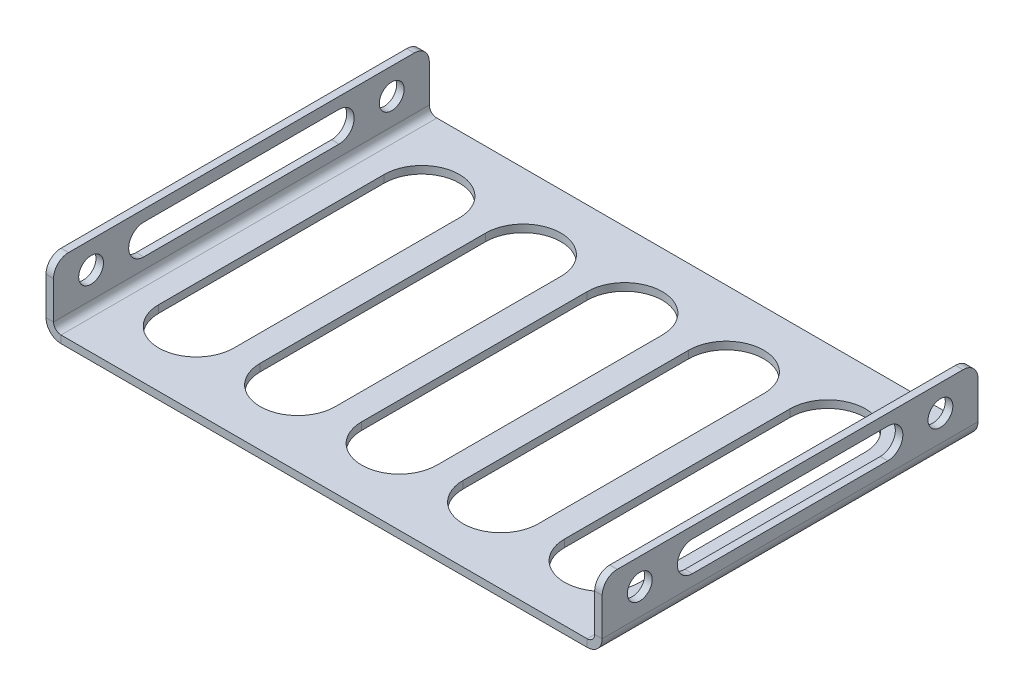
from build123d import *

# Parameters (mm, degrees)
SM_BASE_FLANGE_1_DEPTH   = 25
CUT_EXTRUDE_1_DEPTH      = 46.365184889
CUT_EXTRUDE_1_DEPTH_BACK = 46.365184889
SKETCH_6_R               = 1.65
CUT_EXTRUDE_2_DEPTH      = 10
FILLET_1_R               = 2


# Sheet-metal steps are written as plain solids
with BuildPart() as part:
    # Sketch 1 → 基体-法兰1 (new, symmetric)
    with BuildSketch(Plane.XY):
        with BuildLine():
            Line((-36, 8), (-36, 1))
            ThreePointArc((-36, 1), (-35.707106781, 0.292893219), (-35, 0))
            Line((-35, 0), (35, 0))
            ThreePointArc((35, 0), (35.707106781, 0.292893219), (36, 1))
            Line((36, 1), (36, 8))
            Line((36, 8), (37, 8))
            Line((37, 8), (37, 1))
            ThreePointArc((37, 1), (36.414213562, -0.414213562), (35, -1))
            Line((35, -1), (-35, -1))
            ThreePointArc((-35, -1), (-36.414213562, -0.414213562), (-37, 1))
            Line((-37, 1), (-37, 8))
            Line((-37, 8), (-36, 8))
        make_face()
    extrude(amount=SM_BASE_FLANGE_1_DEPTH, both=True)

    # 草图6 → 切除-拉伸1 (cut, two sides: drawn at the far end of the back side and taken through both)
    with BuildSketch(Plane(origin=(0, 0, 0), x_dir=(0, 0, -1), z_dir=(1, 0, 0)).offset(-CUT_EXTRUDE_1_DEPTH_BACK)):
        with Locations((-20, 4.5)):
            Circle(SKETCH_6_R)
        with Locations((20, 4.5)):
            Circle(SKETCH_6_R)
        with BuildLine():
            Line((-13, 6.5), (13, 6.5))
            ThreePointArc((13, 6.5), (15, 4.5), (13, 2.5))
            Line((13, 2.5), (-13, 2.5))
            ThreePointArc((-13, 2.5), (-15, 4.5), (-13, 6.5))
        make_face()
    extrude(amount=CUT_EXTRUDE_1_DEPTH + CUT_EXTRUDE_1_DEPTH_BACK, mode=Mode.SUBTRACT)

    # 草图7 → 切除-拉伸2 (cut)
    with BuildSketch(Plane.XZ.offset(1)):
        with BuildLine():
            Line((-22, 15), (-22, -15))
            ThreePointArc((-22, -15), (-27, -20), (-32, -15))
            Line((-32, -15), (-32, 15))
            ThreePointArc((-32, 15), (-27, 20), (-22, 15))
        make_face()
        with BuildLine():
            Line((-8.5, 15), (-8.5, -15))
            ThreePointArc((-8.5, -15), (-13.5, -20), (-18.5, -15))
            Line((-18.5, -15), (-18.5, 15))
            ThreePointArc((-18.5, 15), (-13.5, 20), (-8.5, 15))
        make_face()
        with BuildLine():
            Line((5, 15), (5, -15))
            ThreePointArc((5, -15), (0, -20), (-5, -15))
            Line((-5, -15), (-5, 15))
            ThreePointArc((-5, 15), (0, 20), (5, 15))
        make_face()
        with BuildLine():
            Line((18.5, 15), (18.5, -15))
            ThreePointArc((18.5, -15), (13.5, -20), (8.5, -15))
            Line((8.5, -15), (8.5, 15))
            ThreePointArc((8.5, 15), (13.5, 20), (18.5, 15))
        make_face()
        with BuildLine():
            Line((32, 15), (32, -15))
            ThreePointArc((32, -15), (27, -20), (22, -15))
            Line((22, -15), (22, 15))
            ThreePointArc((22, 15), (27, 20), (32, 15))
        make_face()
    extrude(amount=-CUT_EXTRUDE_2_DEPTH, mode=Mode.SUBTRACT)

    # 圆角1
    fillet_1_edges = [part.edges().sort_by_distance(p)[0] for p in [
        (-36.5, 8, -25),
        (36.5, 8, -25),
        (-36.5, 8, 25),
        (36.5, 8, 25),
    ]]
    fillet(fillet_1_edges, radius=FILLET_1_R)


solid = part.part
